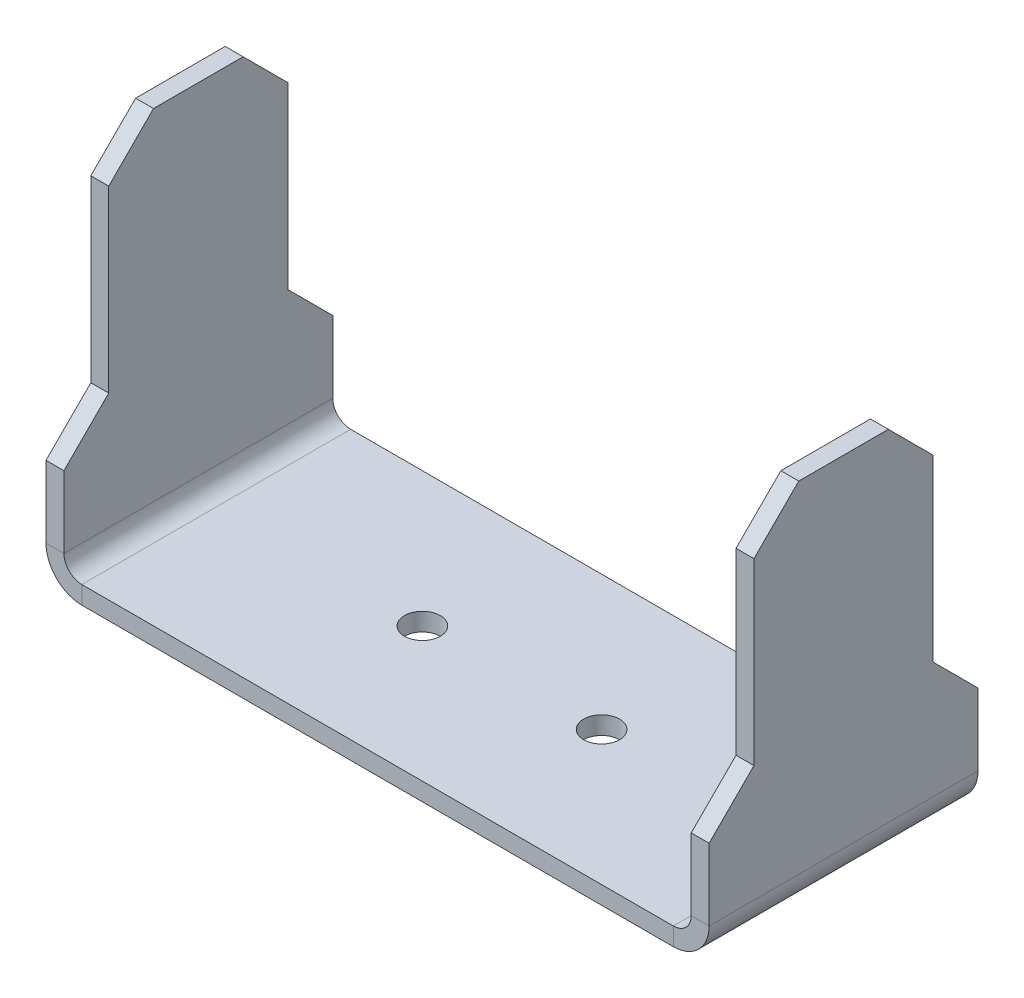
from build123d import *

# Parameters (mm, degrees)
SKETCH_1_W               = 70
SKETCH_1_H               = 30
EXTRUDE_1_DEPTH          = 40
SHEET_START              = -15
SHEET_METAL_1_DEPTH      = 30
SHEET_METAL_1_2_DEPTH    = 30
CUT_EXTRUDE_1_REACH      = 58.515
SKETCH_6_R               = 2
CUT_EXTRUDE_3_DEPTH      = 57.515484604
CUT_EXTRUDE_3_DEPTH_BACK = 57.515484604
CHAMFER_1_SIZE           = 5


# Read off the part's stored shape, not the designer's step: 转换实体1
with BuildPart() as part:
    # Sketch 1 → 凸台-拉伸1 (new body)
    with BuildSketch(Plane(origin=(0, 0, 0), x_dir=(1, 0, 0), z_dir=(0, 1, 0))):
        Rectangle(SKETCH_1_W, SKETCH_1_H)
    extrude(amount=EXTRUDE_1_DEPTH)

    # Sheet Metal 1 outline → Sheet Metal 1 (cut)
    with BuildSketch(Plane.XY.offset(SHEET_START)):
        with BuildLine():
            Line((35, 2), (35, 40))
            Line((35, 40), (-35, 40))
            Line((-35, 40), (-35, 2))
            ThreePointArc((-35, 2), (-34.414213562, 0.585786438), (-33, 0))
            Line((-33, 0), (33, 0))
            ThreePointArc((33, 0), (34.414213562, 0.585786438), (35, 2))
        make_face()
    extrude(amount=SHEET_METAL_1_DEPTH, mode=Mode.SUBTRACT)

    # Sheet Metal 1 2 outline → Sheet Metal 1 2 (add)
    with BuildSketch(Plane.XY.offset(SHEET_START)):
        with BuildLine():
            Line((37, 2), (37, 40))
            Line((37, 40), (35, 40))
            Line((35, 40), (35, 0))
            Line((35, 0), (-35, 0))
            Line((-35, 0), (-35, 40))
            Line((-35, 40), (-37, 40))
            Line((-37, 40), (-37, 2))
            ThreePointArc((-37, 2), (-35.828427125, -0.828427125), (-33, -2))
            Line((-33, -2), (33, -2))
            ThreePointArc((33, -2), (35.828427125, -0.828427125), (37, 2))
        make_face()
    extrude(amount=SHEET_METAL_1_2_DEPTH)

    # 草图6 → 切除-拉伸1 (cut, up to next)
    with BuildSketch(Plane(origin=(0, 0, 0), x_dir=(1, 0, 0), z_dir=(0, 1, 0)), mode=Mode.PRIVATE) as cut_extrude_1_sk1:
        with Locations(Location((-10, 0, 0), (0, 0, 270))):
            Circle(SKETCH_6_R)
    cut_extrude_1_tool1 = extrude(cut_extrude_1_sk1.sketch, amount=-CUT_EXTRUDE_1_REACH, mode=Mode.PRIVATE) & part.part
    # 草图6 → 切除-拉伸1 (cut, up to next)
    with BuildSketch(Plane(origin=(0, 0, 0), x_dir=(1, 0, 0), z_dir=(0, 1, 0)), mode=Mode.PRIVATE) as cut_extrude_1_sk2:
        with Locations(Location((10, 0, 0), (0, 0, 270))):
            Circle(SKETCH_6_R)
    cut_extrude_1_tool2 = extrude(cut_extrude_1_sk2.sketch, amount=-CUT_EXTRUDE_1_REACH, mode=Mode.PRIVATE) & part.part
    add(cut_extrude_1_tool1.solids().sort_by_distance((-10, 0, 0))[0], mode=Mode.SUBTRACT)
    add(cut_extrude_1_tool2.solids().sort_by_distance((10, 0, 0))[0], mode=Mode.SUBTRACT)

    # 草图7 → 切除-拉伸3 (cut, two sides: drawn at the far end of the back side and taken through both)
    with BuildSketch(Plane(origin=(0, 0, 0), x_dir=(0, 0, -1), z_dir=(1, 0, 0)).offset(-CUT_EXTRUDE_3_DEPTH_BACK)):
        Polygon((-15, 10), (-10, 15), (-10, 40), (-15, 40), align=None)
        Polygon((10, 15), (10, 40), (15, 40), (15, 10), align=None)
    extrude(amount=CUT_EXTRUDE_3_DEPTH + CUT_EXTRUDE_3_DEPTH_BACK, mode=Mode.SUBTRACT)

    # 倒角1
    chamfer_1_edges = [part.edges().sort_by_distance(p)[0] for p in [
        (-36, 40, 10),
        (36, 40, 10),
        (-36, 40, -10),
        (36, 40, -10),
    ]]
    chamfer(chamfer_1_edges, length=CHAMFER_1_SIZE)


solid = part.part
